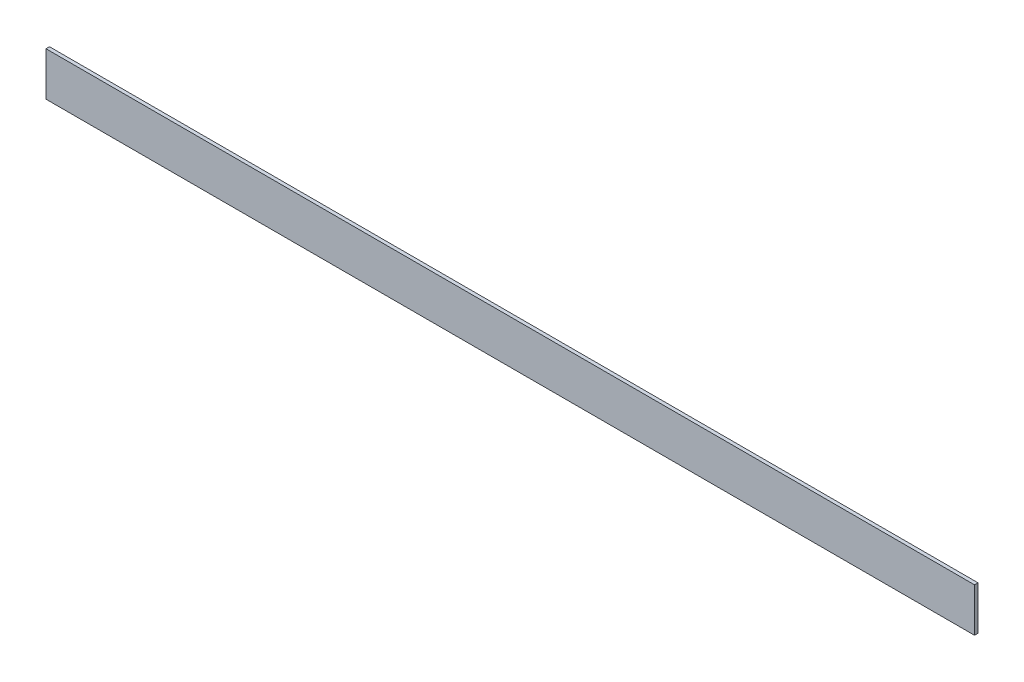
from build123d import *

# Parameters (mm, degrees)
EXTRUDE_1_DEPTH     = 531
SKETCH_2_W          = 23
SKETCH_2_H          = 23
CUT_EXTRUDE_1_DEPTH = 533.175722859


with BuildPart() as part:
    # Эскиз1 → Вытянуть-Тонкостенный1 (new body)
    with BuildSketch(Plane(origin=(0, 0, 0), x_dir=(0, 0, -1), z_dir=(1, 0, 0))):
        Polygon((0, 25), (0, 0), (25, 0), (25, 2), (2, 2), (2, 25), align=None)
    extrude(amount=EXTRUDE_1_DEPTH)

    # Эскиз2 → Вырез-Вытянуть1 (cut, through all)
    with BuildSketch(Plane.XZ):
        with Locations((11.5, -13.5)):
            Rectangle(SKETCH_2_W, SKETCH_2_H)
        with Locations((519.5, -13.5)):
            Rectangle(SKETCH_2_W, SKETCH_2_H)
    extrude(amount=-CUT_EXTRUDE_1_DEPTH, mode=Mode.SUBTRACT)


solid = part.part
